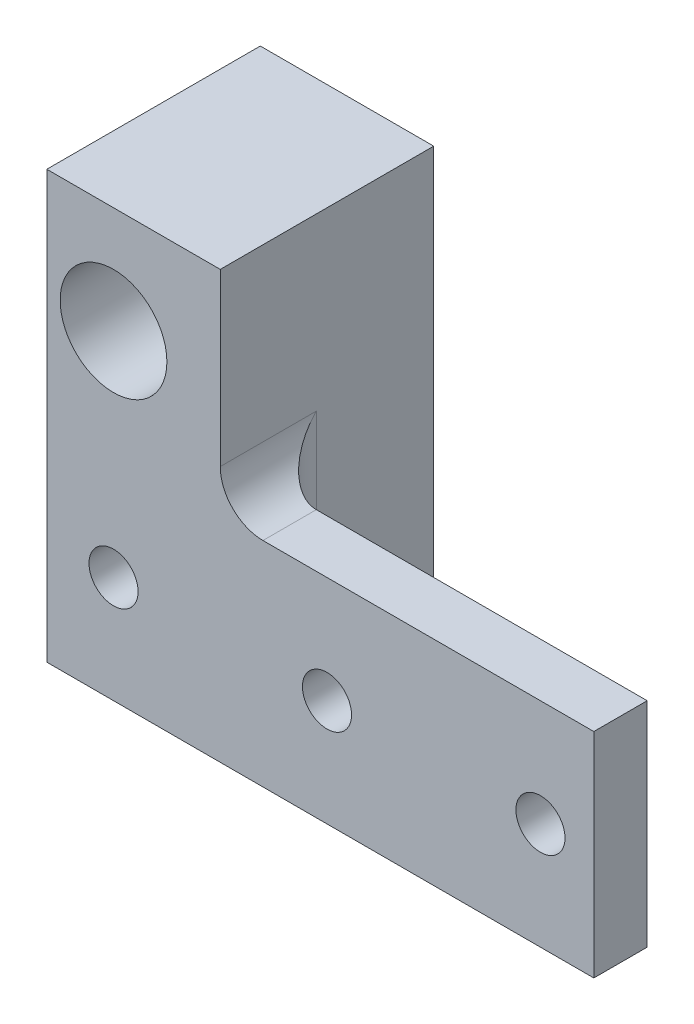
from build123d import *

# Parameters (mm, degrees)
BOSS_EXTRUDE1_DEPTH = 25.4
SKETCH2_R           = 2.921
CUT_EXTRUDE1_DEPTH  = 91.02678768
SKETCH3_W           = 4.7625
SKETCH3_H           = 50.8
CUT_EXTRUDE2_DEPTH  = 91.02678768
SKETCH4_W           = 44.45
SKETCH4_H           = 19.05
CUT_EXTRUDE3_DEPTH  = 91.02678768
FILLET1_R           = 5.08
SKETCH6_R           = 6.35
CUT_EXTRUDE5_DEPTH  = 12.7


with BuildPart() as part:
    # Sketch1 → Boss-Extrude1 (new body)
    with BuildSketch(Plane.XY):
        Polygon((0, 0), (0, 50.8), (25.4, 50.8), (25.4, 25.4), (69.85, 25.4), (69.85, 0), align=None)
    extrude(amount=BOSS_EXTRUDE1_DEPTH)

    # Sketch2 → Cut-Extrude1 (cut, through all)
    with BuildSketch(Plane.XY.offset(25.4)):
        with Locations((12.7, 38.1)):
            Circle(SKETCH2_R)
        with Locations((12.7, 12.7)):
            Circle(SKETCH2_R)
        with Locations((38.1, 12.7)):
            Circle(SKETCH2_R)
        with Locations((63.5, 12.7)):
            Circle(SKETCH2_R)
    extrude(amount=-CUT_EXTRUDE1_DEPTH, mode=Mode.SUBTRACT)

    # Sketch3 → Cut-Extrude2 (cut, through all)
    with BuildSketch(Plane.XY.offset(25.4)):
        with Locations((2.38125, 25.4)):
            Rectangle(SKETCH3_W, SKETCH3_H)
    extrude(amount=-CUT_EXTRUDE2_DEPTH, mode=Mode.SUBTRACT)

    # Sketch4 → Cut-Extrude3 (cut, through all)
    with BuildSketch(Plane.XZ):
        with Locations((47.625, 9.525)):
            Rectangle(SKETCH4_W, SKETCH4_H)
    extrude(amount=-CUT_EXTRUDE3_DEPTH, mode=Mode.SUBTRACT)

    # Fillet1
    fillet1_edges = [part.edges().sort_by_distance(p)[0] for p in [
        (25.4, 12.7, 19.05),
        (25.4, 25.4, 22.225),
    ]]
    fillet(fillet1_edges, radius=FILLET1_R)

    # Sketch6 → Cut-Extrude5 (cut)
    with BuildSketch(Plane.XY.offset(25.4)):
        with Locations((12.7, 38.1)):
            Circle(SKETCH6_R)
    extrude(amount=-CUT_EXTRUDE5_DEPTH, mode=Mode.SUBTRACT)


solid = part.part
